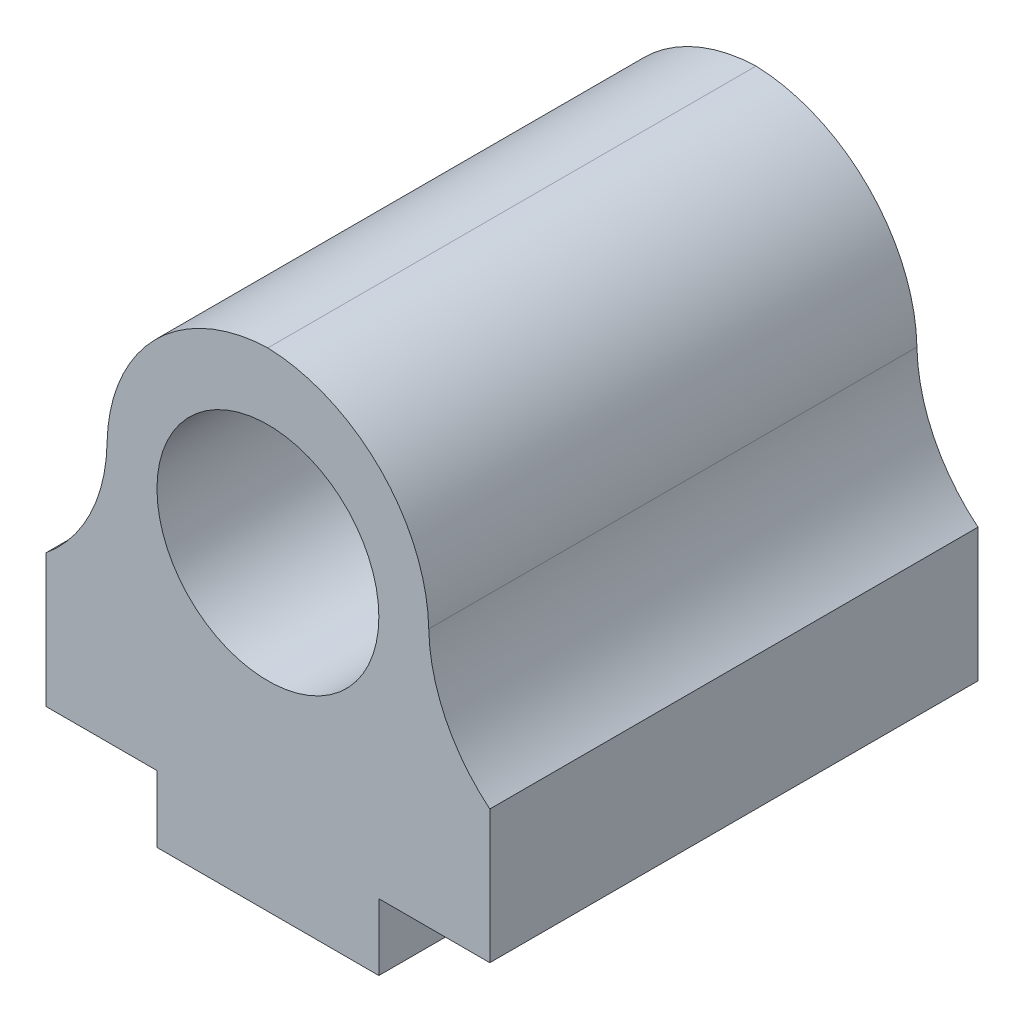
from build123d import *

# Parameters (mm, degrees)
SKETCH6_W           = 20
SKETCH6_H           = 22
BOSS_EXTRUDE5_DEPTH = 6
SKETCH7_W           = 10
SKETCH7_H           = 22
BOSS_EXTRUDE6_DEPTH = 3
SKETCH8_W           = 14.5
SKETCH8_H           = 22
BOSS_EXTRUDE7_DEPTH = 13
SKETCH9_R           = 5
CUT_EXTRUDE1_DEPTH  = 36.284557529
FILLET1_R           = 7.5
FILLET2_R           = 7.5


with BuildPart() as part:
    # Sketch6 → Boss-Extrude5 (new body)
    with BuildSketch(Plane(origin=(0, 0, 0), x_dir=(1, 0, 0), z_dir=(0, 1, 0))):
        with Locations((10, 11)):
            Rectangle(SKETCH6_W, SKETCH6_H)
    extrude(amount=BOSS_EXTRUDE5_DEPTH)

    # Sketch7 → Boss-Extrude6 (add)
    with BuildSketch(Plane.XZ):
        with Locations((10, -11)):
            Rectangle(SKETCH7_W, SKETCH7_H)
    extrude(amount=BOSS_EXTRUDE6_DEPTH)

    # Sketch8 → Boss-Extrude7 (add)
    with BuildSketch(Plane(origin=(0, 6, 0), x_dir=(1, 0, 0), z_dir=(0, 1, 0))):
        with Locations((10, 11)):
            Rectangle(SKETCH8_W, SKETCH8_H)
    extrude(amount=BOSS_EXTRUDE7_DEPTH)

    # Sketch9 → Cut-Extrude1 (cut, through all)
    with BuildSketch(Plane.XY):
        with Locations((10, 11)):
            Circle(SKETCH9_R)
    extrude(amount=-CUT_EXTRUDE1_DEPTH, mode=Mode.SUBTRACT)

    # Fillet1
    # the kernel refuses this fillet: 7.5 mm, written as the material it takes off along each edge
    with BuildSketch(Plane(origin=(17.25, 19, -40.75), x_dir=(-1, 0, 0), z_dir=(0, 0, 1))) as fillet1_piece_1:
        with BuildLine():
            CenterArc((FILLET1_R, FILLET1_R), FILLET1_R, 180, 90)
            Line((0, FILLET1_R), (0, 0))
            Line((0, 0), (FILLET1_R, 0))
        make_face()
    extrude(amount=59.5, mode=Mode.SUBTRACT)
    with BuildSketch(Plane(origin=(2.75, 19, 18.75), x_dir=(0, -1, 0), z_dir=(0, 0, -1))) as fillet1_piece_2:
        with BuildLine():
            CenterArc((FILLET1_R, -FILLET1_R), FILLET1_R, 90, 90)
            Line((0, -FILLET1_R), (0, 0))
            Line((0, 0), (FILLET1_R, 0))
        make_face()
    extrude(amount=59.5, mode=Mode.SUBTRACT)

    # Fillet2
    # the kernel refuses this fillet: 7.5 mm, written as the material it adds along each edge
    with BuildSketch(Plane(origin=(17.25, 6, -22), x_dir=(1, 0, 0), z_dir=(0, 0, 1))) as fillet2_piece_1:
        with BuildLine():
            CenterArc((7.496865043, 5.806657581), FILLET2_R, 181.171427285, 49.563032728)
            Line((-0.001567478, 5.65332879), (-0.75141073, 5.637995911))
            ThreePointArc((-0.75141073, 5.637995911), (-0.75, 5.5), (-0.75, 0))
            Line((-0.75, 0), (0, -0.75))
            ThreePointArc((0, -0.75), (1.375, -0.75), (2.275313496, -0.580665758))
            Line((2.275313496, -0.580665758), (2.75, 0))
        make_face()
    extrude(amount=22)
    with BuildSketch(Plane(origin=(2.75, 6, 0), x_dir=(0.00027726642617420565, 0.9999999615616638, 0), z_dir=(0, 0, -1))) as fillet2_piece_2:
        with BuildLine():
            CenterArc((5.804578729, -7.498474746), FILLET2_R, 91.155541089, 49.563032728)
            Line((-0.000762483, -2.749999894), (-0.581296604, -2.275152409))
            ThreePointArc((-0.581296604, -2.275152409), (-0.750381213, -1.374791997), (-0.749999971, 0.00020795))
            Line((-0.749999971, 0.00020795), (0.00020795, 0.749999971))
            ThreePointArc((0.00020795, 0.749999971), (5.500207738, 0.748475006), (5.638204036, 0.749847475))
            Line((5.638204036, 0.749847475), (5.653329008, 0))
        make_face()
    extrude(amount=22)


solid = part.part
